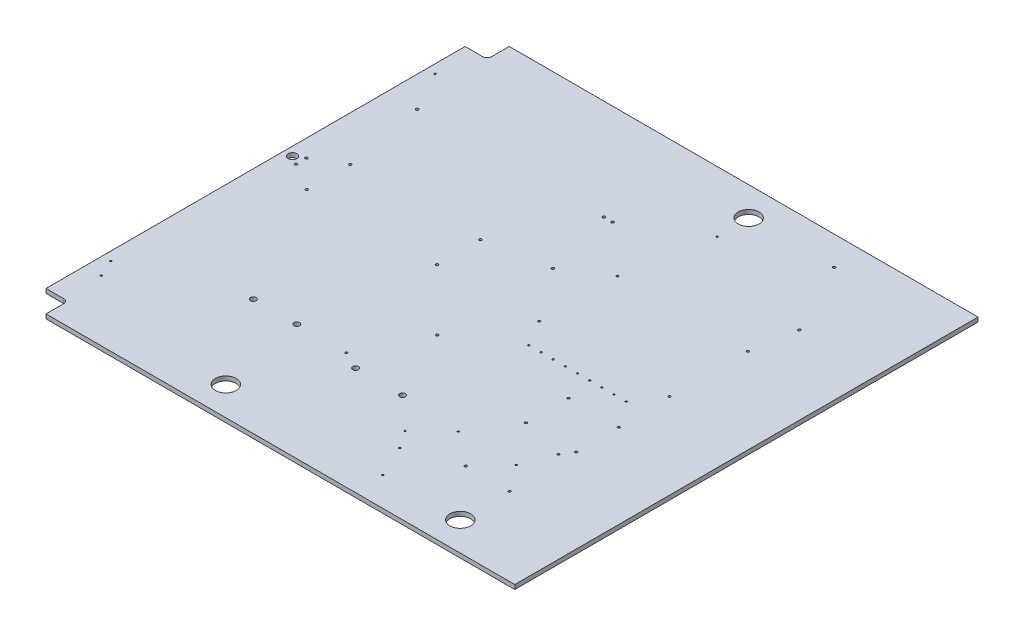
from build123d import *

# Parameters (mm, degrees)
SKETCH1_W                                     = 533.4
SKETCH1_H                                     = 5
BOSS_EXTRUDE1_DEPTH                           = 565.15
BOTTHOMHOLES_SKETCH2_R                        = 12
BOTTOMSTEPPERHOLES_CUT_EXTRUDE1_DEPTH         = 778.132602906
BOTTOMPSUHOLESSKETCH2_R                       = 1.5
BOTTOMPSUHOLESSKETCH2_R_2                     = 3.25
BOTTOMPSUHOLESCUT_EXTRUDE1_DEPTH              = 778.132602906
OCTOPUSHOLESSKETCH2_R                         = 1.35
OCTOPUSMOUNTHOLESCUT_EXTRUDE1_DEPTH           = 778.132602906
POWRCABLEGUIDEMOUNTHOLESSKETCH2_R             = 1.5
POWERCABLEGUIDEMOUNTHOLESCUT_EXTRUDE1_DEPTH   = 778.132602906
RPIHOLESSKETCH2_R                             = 1.35
RPIMOUNTHOLESCUT_EXTRUDE1_DEPTH               = 778.132602906
DRAGCHAINANDCABLEGUIDEHOLESSKETCH2_R          = 1.5
DRAGCHAINANDCABLEGUIDEHOLESSKETCH2_R_2        = 5
CRAGCHAINANDCABLEGUIDEHOLESCUT_EXTRUDE1_DEPTH = 778.132602906
SKETCH2_R                                     = 1
OCTOPUSROUTING_HOLESCUT_EXTRUDE1_DEPTH        = 778.132602906
PIPOWERANDSSRCONTROLSKETCH3_R                 = 1.25
PIPOWERANDSSRCONTROLCUTS_EXTRUDE1_DEPTH       = 778.132602906
CORNERCABLEKNOTCHCUT_EXTRUDE1_DEPTH           = 778.132602906
Z1_PATHSSKETCH4_R                             = 1.5
Z1_PATGSCUT_EXTRUDE1_DEPTH                    = 778.132602906
Z2PATHSSKETCH5_R                              = 1
Z2PATHSCUT_EXTRUDE2_DEPTH                     = 778.132602906
ZPATHSSKETCH4_R                               = 1.35
ZPATHSCUT_EXTRUDE1_DEPTH                      = 778.132602906
LEFTGANTRYANDEXTRUDERPATHSSKETCH4_R           = 1
LEFTGANTRYANDEXTRUDERPATHSCUT_EXTRUDE1_DEPTH  = 778.132602906
RIGHTGANTRYPATHSSKETCH5_R                     = 1
RIGHTGANTRYPATHSCUT_EXTRUDE2_DEPTH            = 778.132602906


with BuildPart() as part:
    # Sketch1 → Boss-Extrude1 (new body)
    with BuildSketch(Plane(origin=(0, 0, 0), x_dir=(0, 0, -1), z_dir=(1, 0, 0))):
        with Locations((-266.7, 2.5)):
            Rectangle(SKETCH1_W, SKETCH1_H)
    extrude(amount=BOSS_EXTRUDE1_DEPTH)

    # BotthomHoles-Sketch2 → BottomStepperHoles-Cut-Extrude1 (cut, through all)
    with BuildSketch(Plane(origin=(0, 5, 0), x_dir=(1, 0, 0), z_dir=(0, 1, 0))):
        with Locations((334.275, -33.175)):
            Circle(BOTTHOMHOLES_SKETCH2_R)
        with Locations((199.275, -500.225)):
            Circle(BOTTHOMHOLES_SKETCH2_R)
        with Locations((469.275, -500.225)):
            Circle(BOTTHOMHOLES_SKETCH2_R)
    extrude(amount=-BOTTOMSTEPPERHOLES_CUT_EXTRUDE1_DEPTH, mode=Mode.SUBTRACT)

    # BottomPSUHolesSketch2 → BottomPSUHolesCut-Extrude1 (cut, through all)
    with BuildSketch(Plane(origin=(0, 5, 0), x_dir=(1, 0, 0), z_dir=(0, 1, 0))):
        with Locations((201.5, -209.2)):
            Circle(BOTTOMPSUHOLESSKETCH2_R)
        with Locations((201.5, -259.2)):
            Circle(BOTTOMPSUHOLESSKETCH2_R)
        with Locations((51.5, -209.2)):
            Circle(BOTTOMPSUHOLESSKETCH2_R)
        with Locations((51.5, -259.2)):
            Circle(BOTTOMPSUHOLESSKETCH2_R)
        with Locations((180, -399.2)):
            Circle(BOTTOMPSUHOLESSKETCH2_R_2)
        with Locations((130, -399.2)):
            Circle(BOTTOMPSUHOLESSKETCH2_R_2)
        with Locations((257.75, -409.2)):
            Circle(BOTTOMPSUHOLESSKETCH2_R_2)
        with Locations((311.75, -409.2)):
            Circle(BOTTOMPSUHOLESSKETCH2_R_2)
    extrude(amount=-BOTTOMPSUHOLESCUT_EXTRUDE1_DEPTH, mode=Mode.SUBTRACT)

    # OctopusHolesSketch2 → OctopusMountHolesCut-Extrude1 (cut, through all)
    with BuildSketch(Plane(origin=(0, 5, 0), x_dir=(1, 0, 0), z_dir=(0, 1, 0))):
        with Locations((316.75, -256.7)):
            Circle(OCTOPUSHOLESSKETCH2_R)
        with Locations((466.75, -256.7)):
            Circle(OCTOPUSHOLESSKETCH2_R)
        with Locations((316.75, -166.7)):
            Circle(OCTOPUSHOLESSKETCH2_R)
        with Locations((466.75, -166.7)):
            Circle(OCTOPUSHOLESSKETCH2_R)
    extrude(amount=-OCTOPUSMOUNTHOLESCUT_EXTRUDE1_DEPTH, mode=Mode.SUBTRACT)

    # PowrCableGuideMountHolesSketch2 → PowerCableGuideMountHolesCut-Extrude1 (cut, through all)
    with BuildSketch(Plane(origin=(0, 5, 0), x_dir=(1, 0, 0), z_dir=(0, 1, 0))):
        with Locations((271.75, -329.2)):
            Circle(POWRCABLEGUIDEMOUNTHOLESSKETCH2_R)
        with Locations((271.75, -196.2)):
            Circle(POWRCABLEGUIDEMOUNTHOLESSKETCH2_R)
    extrude(amount=-POWERCABLEGUIDEMOUNTHOLESCUT_EXTRUDE1_DEPTH, mode=Mode.SUBTRACT)

    # RPIHolesSketch2 → RPIMountHolesCut-Extrude1 (cut, through all)
    with BuildSketch(Plane(origin=(0, 5, 0), x_dir=(1, 0, 0), z_dir=(0, 1, 0))):
        with Locations((468.25, -316.7)):
            Circle(RPIHOLESSKETCH2_R)
        with Locations((468.25, -365.7)):
            Circle(RPIHOLESSKETCH2_R)
        with Locations((410.25, -316.7)):
            Circle(RPIHOLESSKETCH2_R)
        with Locations((410.25, -365.7)):
            Circle(RPIHOLESSKETCH2_R)
    extrude(amount=-RPIMOUNTHOLESCUT_EXTRUDE1_DEPTH, mode=Mode.SUBTRACT)

    # DragChainAndCableGuideHolesSketch2 → CragChainAndCableGuideHolesCut-Extrude1 (cut, through all)
    with BuildSketch(Plane(origin=(0, 5, 0), x_dir=(1, 0, 0), z_dir=(0, 1, 0))):
        with Locations((260, -115.65)):
            Circle(DRAGCHAINANDCABLEGUIDEHOLESSKETCH2_R)
        with Locations((10, -234.2)):
            Circle(DRAGCHAINANDCABLEGUIDEHOLESSKETCH2_R_2)
        with Locations((475, -115.65)):
            Circle(DRAGCHAINANDCABLEGUIDEHOLESSKETCH2_R)
        with Locations((250, -115.65)):
            Circle(DRAGCHAINANDCABLEGUIDEHOLESSKETCH2_R)
        with Locations((35, -115.65)):
            Circle(DRAGCHAINANDCABLEGUIDEHOLESSKETCH2_R)
        with Locations((20, -240.2)):
            Circle(DRAGCHAINANDCABLEGUIDEHOLESSKETCH2_R)
        with Locations((20, -228.2)):
            Circle(DRAGCHAINANDCABLEGUIDEHOLESSKETCH2_R)
    extrude(amount=-CRAGCHAINANDCABLEGUIDEHOLESCUT_EXTRUDE1_DEPTH, mode=Mode.SUBTRACT)

    # Sketch2 → OctopusRouting holesCut-Extrude1 (cut, through all)
    with BuildSketch(Plane(origin=(0, 5, 0), x_dir=(1, 0, 0), z_dir=(0, 1, 0))):
        with Locations((334.75, -286.7)):
            Circle(SKETCH2_R)
        with Locations((348.75, -286.7)):
            Circle(SKETCH2_R)
        with Locations((362.75, -286.7)):
            Circle(SKETCH2_R)
        with Locations((376.75, -286.7)):
            Circle(SKETCH2_R)
        with Locations((390.75, -286.7)):
            Circle(SKETCH2_R)
        with Locations((404.75, -286.7)):
            Circle(SKETCH2_R)
        with Locations((418.75, -286.7)):
            Circle(SKETCH2_R)
        with Locations((432.75, -286.7)):
            Circle(SKETCH2_R)
        with Locations((446.75, -286.7)):
            Circle(SKETCH2_R)
    extrude(amount=-OCTOPUSROUTING_HOLESCUT_EXTRUDE1_DEPTH, mode=Mode.SUBTRACT)

    # PiPowerAndSSRControlSketch3 → PiPowerAndSSRControlCuts-Extrude1 (cut, through all)
    with BuildSketch(Plane(origin=(0, 5, 0), x_dir=(1, 0, 0), z_dir=(0, 1, 0))):
        with Locations((237, -399.2)):
            Circle(PIPOWERANDSSRCONTROLSKETCH3_R)
        with Locations((460.5, -378.4)):
            Circle(PIPOWERANDSSRCONTROLSKETCH3_R)
    extrude(amount=-PIPOWERANDSSRCONTROLCUTS_EXTRUDE1_DEPTH, mode=Mode.SUBTRACT)

    # CornerCableKnotchesSketch4 → CornerCableKnotchCut-Extrude1 (cut, through all)
    with BuildSketch(Plane(origin=(0, 5, 0), x_dir=(1, 0, 0), z_dir=(0, 1, 0))):
        with BuildLine():
            Line((0, -25.4), (20.4, -25.4))
            ThreePointArc((20.4, -25.4), (23.935533906, -23.935533906), (25.4, -20.4))
            Line((25.4, -20.4), (25.4, 0))
            Line((25.4, 0), (0, 0))
            Line((0, 0), (0, -25.4))
        make_face()
        with BuildLine():
            Line((0, -508), (20.4, -508))
            ThreePointArc((20.4, -508), (23.935533906, -509.464466094), (25.4, -513))
            Line((25.4, -513), (25.4, -533.4))
            Line((25.4, -533.4), (0, -533.4))
            Line((0, -533.4), (0, -508))
        make_face()
    extrude(amount=-CORNERCABLEKNOTCHCUT_EXTRUDE1_DEPTH, mode=Mode.SUBTRACT)

    # Z1 pathsSketch4 → Z1 patgsCut-Extrude1 (cut, through all)
    with BuildSketch(Plane(origin=(0, 5, 0), x_dir=(1, 0, 0), z_dir=(0, 1, 0))):
        with Locations((432.75, -33.175)):
            Circle(Z1_PATHSSKETCH4_R)
    extrude(amount=-Z1_PATGSCUT_EXTRUDE1_DEPTH, mode=Mode.SUBTRACT)

    # Z2PathsSketch5 → Z2PathsCut-Extrude2 (cut, through all)
    with BuildSketch(Plane(origin=(0, 5, 0), x_dir=(1, 0, 0), z_dir=(0, 1, 0))):
        with Locations((380, -500.225)):
            Circle(Z2PATHSSKETCH5_R)
        with Locations((380, -413.4)):
            Circle(Z2PATHSSKETCH5_R)
        with Locations((446.75, -413.4)):
            Circle(Z2PATHSSKETCH5_R)
    extrude(amount=-Z2PATHSCUT_EXTRUDE2_DEPTH, mode=Mode.SUBTRACT)

    # ZPathsSketch4 → ZPathsCut-Extrude1 (cut, through all)
    with BuildSketch(Plane(origin=(0, 5, 0), x_dir=(1, 0, 0), z_dir=(0, 1, 0))):
        with Locations((469.275, -443.4)):
            Circle(ZPATHSSKETCH4_R)
        with Locations((418.75, -443.4)):
            Circle(ZPATHSSKETCH4_R)
    extrude(amount=-ZPATHSCUT_EXTRUDE1_DEPTH, mode=Mode.SUBTRACT)

    # LeftGantryAndExtruderPathsSketch4 → LeftGantryAndExtruderPathsCut-Extrude1 (cut, through all)
    with BuildSketch(Plane(origin=(0, 5, 0), x_dir=(1, 0, 0), z_dir=(0, 1, 0))):
        with Locations((348.75, -443.4)):
            Circle(LEFTGANTRYANDEXTRUDERPATHSSKETCH4_R)
        with Locations((362.75, -463.4)):
            Circle(LEFTGANTRYANDEXTRUDERPATHSSKETCH4_R)
        with Locations((10, -443.4)):
            Circle(LEFTGANTRYANDEXTRUDERPATHSSKETCH4_R)
        with Locations((19, -463.4)):
            Circle(LEFTGANTRYANDEXTRUDERPATHSSKETCH4_R)
    extrude(amount=-LEFTGANTRYANDEXTRUDERPATHSCUT_EXTRUDE1_DEPTH, mode=Mode.SUBTRACT)

    # RightGantryPathsSketch5 → RightGantryPathsCut-Extrude2 (cut, through all)
    with BuildSketch(Plane(origin=(0, 5, 0), x_dir=(1, 0, 0), z_dir=(0, 1, 0))):
        with Locations((334.75, -70)):
            Circle(RIGHTGANTRYPATHSSKETCH5_R)
        with Locations((10, -70)):
            Circle(RIGHTGANTRYPATHSSKETCH5_R)
    extrude(amount=-RIGHTGANTRYPATHSCUT_EXTRUDE2_DEPTH, mode=Mode.SUBTRACT)


solid = part.part
